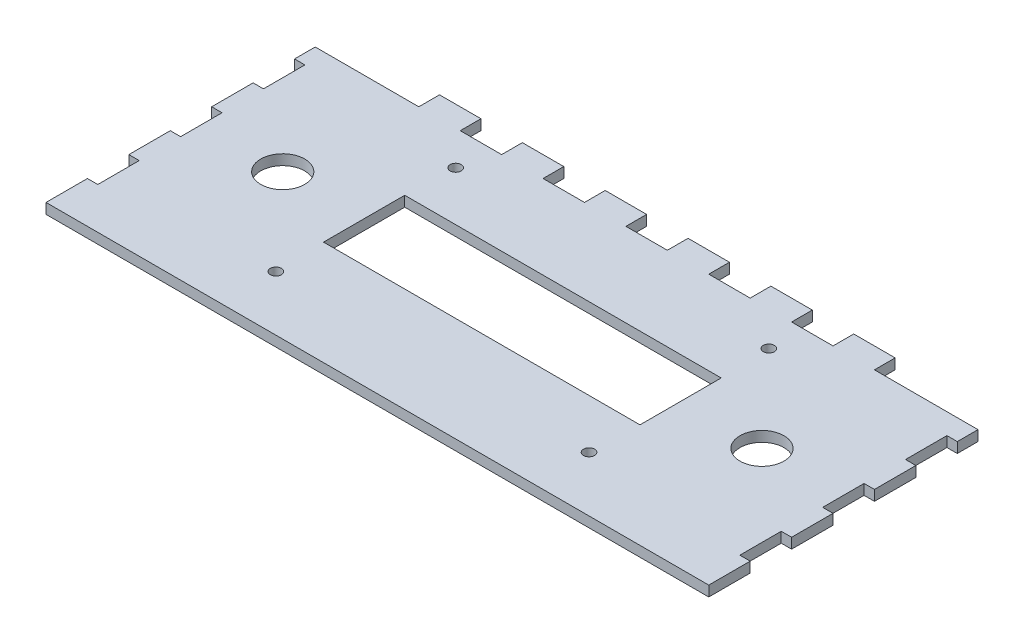
from build123d import *

# Parameters (mm, degrees)
SKETCH1_W             = 203.2
SKETCH1_H             = 88.9
BOSS_EXTRUDE1_DEPTH   = 3.175
SKETCH2_W             = 3.175
SKETCH2_H             = 12.7
SKETCH2_W_2           = 31.75
SKETCH2_H_2           = 6.35
SKETCH2_W_3           = 12.7
CUT_EXTRUDE1_DEPTH    = 222.818688629
SKETCH3_W             = 97.028
SKETCH3_H             = 24.892
CUT_EXTRUDE2_DEPTH    = 222.818688629
M3_CLEARANCE_HOLE1_D  = 3.4
M12_CLEARANCE_HOLE1_D = 13.5


with BuildPart() as part:
    # Sketch1 → Boss-Extrude1 (new body)
    with BuildSketch(Plane(origin=(0, 0, 0), x_dir=(1, 0, 0), z_dir=(0, 1, 0))):
        with Locations((101.6, 44.45)):
            Rectangle(SKETCH1_W, SKETCH1_H)
    extrude(amount=BOSS_EXTRUDE1_DEPTH)

    # Sketch2 → Cut-Extrude1 (cut, through all)
    with BuildSketch(Plane(origin=(0, 3.175, 0), x_dir=(1, 0, 0), z_dir=(0, 1, 0))):
        with Locations((201.6125, 19.05)):
            Rectangle(SKETCH2_W, SKETCH2_H)
        with Locations((201.6125, 44.45)):
            Rectangle(SKETCH2_W, SKETCH2_H)
        with Locations((201.6125, 69.85)):
            Rectangle(SKETCH2_W, SKETCH2_H)
        with Locations((187.325, 85.725)):
            Rectangle(SKETCH2_W_2, SKETCH2_H_2)
        with Locations((152.4, 85.725)):
            Rectangle(SKETCH2_W_3, SKETCH2_H_2)
        with Locations((127, 85.725)):
            Rectangle(SKETCH2_W_3, SKETCH2_H_2)
        with Locations((101.6, 85.725)):
            Rectangle(SKETCH2_W_3, SKETCH2_H_2)
        with Locations((76.2, 85.725)):
            Rectangle(SKETCH2_W_3, SKETCH2_H_2)
        with Locations((50.8, 85.725)):
            Rectangle(SKETCH2_W_3, SKETCH2_H_2)
        with Locations((1.5875, 19.05)):
            Rectangle(SKETCH2_W, SKETCH2_H)
        with Locations((1.5875, 44.45)):
            Rectangle(SKETCH2_W, SKETCH2_H)
        with Locations((1.5875, 69.85)):
            Rectangle(SKETCH2_W, SKETCH2_H)
        with Locations((15.875, 85.725)):
            Rectangle(SKETCH2_W_2, SKETCH2_H_2)
    extrude(amount=-CUT_EXTRUDE1_DEPTH, mode=Mode.SUBTRACT)

    # Sketch3 → Cut-Extrude2 (cut, through all)
    with BuildSketch(Plane.XZ):
        with Locations((101.6, -44.45)):
            Rectangle(SKETCH3_W, SKETCH3_H)
    extrude(amount=-CUT_EXTRUDE2_DEPTH, mode=Mode.SUBTRACT)

    # M3 Clearance Hole1 (through all)
    with Locations(Plane(origin=(0, 0, 0), x_dir=(-1, 0, 0), z_dir=(0, -1, 0))):
        with Locations((-149.606, 72.009), (-149.606, 16.891), (-53.594, 16.891), (-53.594, 72.009)):
            Hole(M3_CLEARANCE_HOLE1_D / 2)

    # M12 Clearance Hole1 (through all)
    with Locations(Plane(origin=(0, 0, 0), x_dir=(-1, 0, 0), z_dir=(0, -1, 0))):
        with Locations((-175.0695, 44.45), (-28.1305, 44.45)):
            Hole(M12_CLEARANCE_HOLE1_D / 2)


solid = part.part
